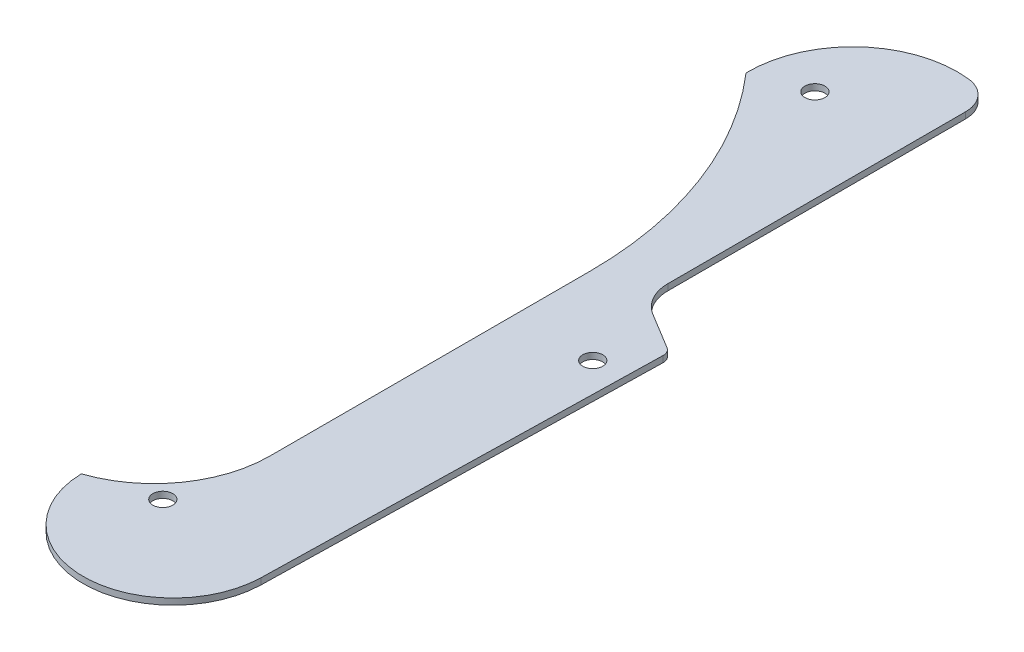
from build123d import *

# Parameters (mm, degrees)
BOSS_EXTRUDE1_DEPTH = 0.625
CUT_EXTRUDE3_DEPTH  = 0.625
FILLET1_START       = -1
FILLET1_DEPTH       = 3
CUT_EXTRUDE4_REACH  = 81.183
SKETCH5_R           = 1


with BuildPart() as part:
    # Sketch2 → Boss-Extrude1 (new body)
    with BuildSketch(Plane(origin=(0, 0, 0), x_dir=(1, 0, 0), z_dir=(0, 1, 0))):
        with BuildLine():
            Line((8.997858244, -0.196333965), (9.856747342, 39.165996151))
            ThreePointArc((9.856747342, 39.165996151), (9.733712071, 39.668799805), (9.375758573, 40.042722907))
            Line((9.375758573, 40.042722907), (5.794249139, 42.216036183))
            ThreePointArc((5.794249139, 42.216036183), (4.383630471, 43.673589393), (3.869342172, 45.635683666))
            Line((3.869342172, 45.635683666), (3.869342172, 77.038914875))
            ThreePointArc((3.869342172, 77.038914875), (3.676362717, 77.629438236), (3.171906493, 77.992043844))
            ThreePointArc((3.171906493, 77.992043844), (-6.282617519, 76.39229695), (-10.480917414, 67.771305568))
            Line((-10.480917414, 67.771305568), (-8.997858244, -0.196333965))
            ThreePointArc((-8.997858244, -0.196333965), (0, -9), (8.997858244, -0.196333965))
        make_face()
    extrude(amount=BOSS_EXTRUDE1_DEPTH)

    # Sketch3 → Cut-Extrude3 (cut)
    with BuildSketch(Plane(origin=(0, 0.625, 0), x_dir=(1, 0, 0), z_dir=(0, 1, 0))):
        with BuildLine():
            Line((-8.997858244, -0.196333965), (-10.481573544, 67.803666035))
            ThreePointArc((-10.481573544, 67.803666035), (-3.525742077, 56.156825546), (-1.104262014, 42.808832473))
            Line((-1.104262014, 42.808832473), (-1.104262014, 10.808832473))
            ThreePointArc((-1.104262014, 10.808832473), (-3.281700426, 4.037153402), (-8.997858244, -0.196333965))
        make_face()
    extrude(amount=-CUT_EXTRUDE3_DEPTH, mode=Mode.SUBTRACT)


with BuildPart() as body_2:
    # of the pieces the cut leaves, the one that is kept (cut_extrude3_keep)
    add(part.part.solids().sort_by_distance((8.997858244, 0, 0.196333965))[0])

    # Fillet1: read off the stored shape, not the designer's step
    # Fillet1 outline → Fillet1 (cut)
    with BuildSketch(Plane(origin=(0, 0, 0), x_dir=(1, 0, 0), z_dir=(0, 1, 0)).offset(FILLET1_START)):
        with BuildLine():
            ThreePointArc((3.171906493, 77.992043844), (2.204919962, 78.248915013), (1.217849838, 78.412433565))
            ThreePointArc((1.217849838, 78.412433565), (3.110493996, 77.427046766), (3.869342172, 75.432745259))
            Line((3.869342172, 75.432745259), (3.869342172, 77.038914875))
            ThreePointArc((3.869342172, 77.038914875), (3.676362717, 77.629438236), (3.171906493, 77.992043844))
        make_face()
    extrude(amount=FILLET1_DEPTH, mode=Mode.SUBTRACT)

    # Sketch5 → Cut-Extrude4 (cut, up to next)
    with BuildSketch(Plane.XZ, mode=Mode.PRIVATE) as cut_extrude4_sk1:
        with Locations(Location((-5.399070001, -69.616613762, 0), (0, 0, 270))):
            Circle(SKETCH5_R)
    cut_extrude4_tool1 = extrude(cut_extrude4_sk1.sketch, amount=-CUT_EXTRUDE4_REACH, mode=Mode.PRIVATE) & body_2.part
    # Sketch5 → Cut-Extrude4 (cut, up to next)
    with BuildSketch(Plane.XZ, mode=Mode.PRIVATE) as cut_extrude4_sk2:
        with Locations(Location((6.76984482, -35.216036183, 0), (0, 0, 270))):
            Circle(SKETCH5_R)
    cut_extrude4_tool2 = extrude(cut_extrude4_sk2.sketch, amount=-CUT_EXTRUDE4_REACH, mode=Mode.PRIVATE) & body_2.part
    # Sketch5 → Cut-Extrude4 (cut, up to next)
    with BuildSketch(Plane.XZ, mode=Mode.PRIVATE) as cut_extrude4_sk3:
        with Locations(Location((-2.705062156, -1.67, 0), (0, 0, 270))):
            Circle(SKETCH5_R)
    cut_extrude4_tool3 = extrude(cut_extrude4_sk3.sketch, amount=-CUT_EXTRUDE4_REACH, mode=Mode.PRIVATE) & body_2.part
    add(cut_extrude4_tool1.solids().sort_by_distance((-5.39907, 0, -69.616614))[0], mode=Mode.SUBTRACT)
    add(cut_extrude4_tool2.solids().sort_by_distance((6.769845, 0, -35.216036))[0], mode=Mode.SUBTRACT)
    add(cut_extrude4_tool3.solids().sort_by_distance((-2.705062, 0, -1.67))[0], mode=Mode.SUBTRACT)


solid = body_2.part
